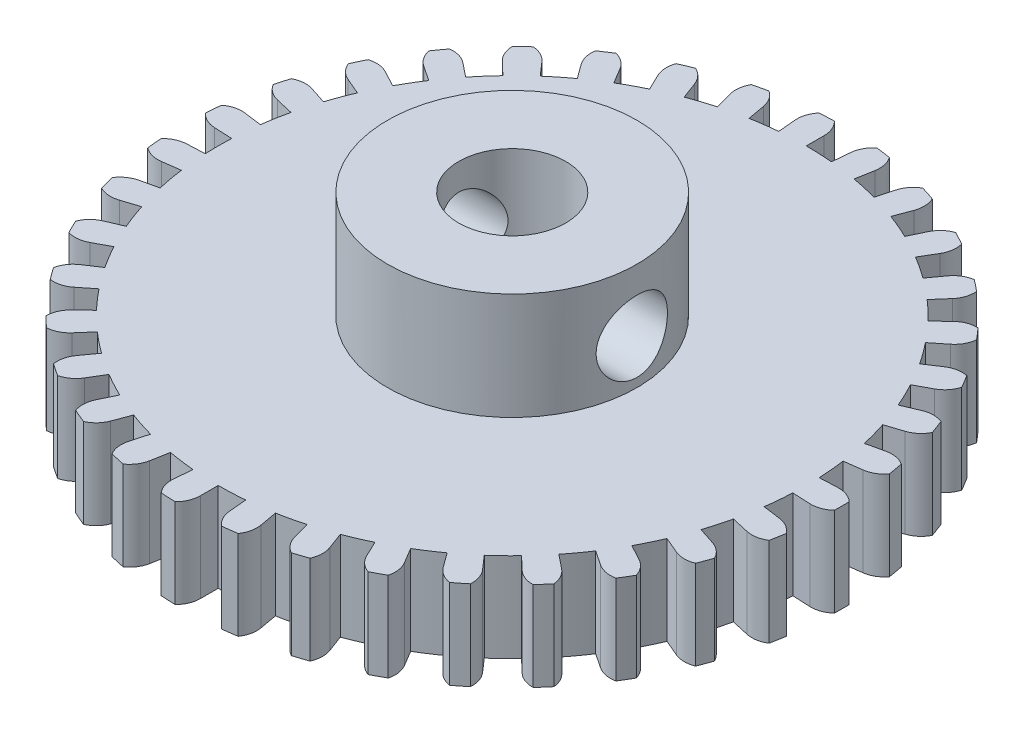
from build123d import *

# Parameters (mm, degrees)
BOSS_EXTRUDE1_DEPTH     = 5
CIRPATTERN1_COUNT       = 35
CUT_EXTRUDE1_DEPTH      = 27.633209195
CUT_EXTRUDE1_DEPTH_BACK = 27.633209195
SKETCH2_R               = 3
BOSS_EXTRUDE2_START     = 6
SKETCH2_3_R             = 7
SKETCH2_3_R_2           = 3
BOSS_EXTRUDE2_DEPTH     = 6
CUT_EXTRUDE2_DEPTH      = 29.378298611
CUT_EXTRUDE2_DEPTH_BACK = 29.378298611
SKETCH3_R               = 2


with BuildPart() as part:
    # Sketch1 → Boss-Extrude1 (new body)
    with BuildSketch(Plane(origin=(0, 0, 0), x_dir=(1, 0, 0), z_dir=(0, 1, 0))):
        with BuildLine():
            Line((16.483371752, 0.740577939), (17.482363979, 0.785461451))
            ThreePointArc((17.482363979, 0.785461451), (18.025915192, 0.701791343), (18.495338464, 0.415277121))
            ThreePointArc((18.495338464, 0.415277121), (18.5, 0), (18.495338464, -0.415277121))
            ThreePointArc((18.495338464, -0.415277121), (18.025915192, -0.701791343), (17.482363979, -0.785461451))
            Line((17.482363979, -0.785461451), (16.483371752, -0.740577939))
            ThreePointArc((16.483371752, -0.740577939), (16.462594298, -1.110400368), (16.433520523, -1.47966321))
            Line((16.433520523, -1.47966321), (0, 0))
            Line((0, 0), (16.433520523, 1.47966321))
            ThreePointArc((16.433520523, 1.47966321), (16.462594298, 1.110400368), (16.483371752, 0.740577939))
        make_face()
    boss_extrude1 = extrude(amount=BOSS_EXTRUDE1_DEPTH)

    # CirPattern1: Boss-Extrude1 ×35 about axis
    cirpattern1_axis = Axis((0, 5, 0), (0, -1, 0))
    for i in range(1, CIRPATTERN1_COUNT):
        add(boss_extrude1.rotate(cirpattern1_axis, i * 360 / CIRPATTERN1_COUNT))

    # Sketch2 → Cut-Extrude1 (cut, two sides: drawn at the far end of the back side and taken through both)
    with BuildSketch(Plane(origin=(0, 5, 0), x_dir=(1, 0, 0), z_dir=(0, 1, 0)).offset(-CUT_EXTRUDE1_DEPTH_BACK)):
        Circle(SKETCH2_R)
    extrude(amount=CUT_EXTRUDE1_DEPTH + CUT_EXTRUDE1_DEPTH_BACK, mode=Mode.SUBTRACT)

    # Sketch2<3> → Boss-Extrude2 (add)
    with BuildSketch(Plane(origin=(0, 5, 0), x_dir=(1, 0, 0), z_dir=(0, 1, 0)).offset(BOSS_EXTRUDE2_START)):
        Circle(SKETCH2_3_R)
        Circle(SKETCH2_3_R_2, mode=Mode.SUBTRACT)
    extrude(amount=-BOSS_EXTRUDE2_DEPTH)

    # Sketch3 → Cut-Extrude2 (cut, two sides: drawn at the far end of the back side and taken through both)
    with BuildSketch(Plane(origin=(0, 0, 0), x_dir=(0, 0, -1), z_dir=(1, 0, 0)).offset(-CUT_EXTRUDE2_DEPTH_BACK)):
        with Locations((0, 7.5)):
            Circle(SKETCH3_R)
    extrude(amount=CUT_EXTRUDE2_DEPTH + CUT_EXTRUDE2_DEPTH_BACK, mode=Mode.SUBTRACT)


solid = part.part
